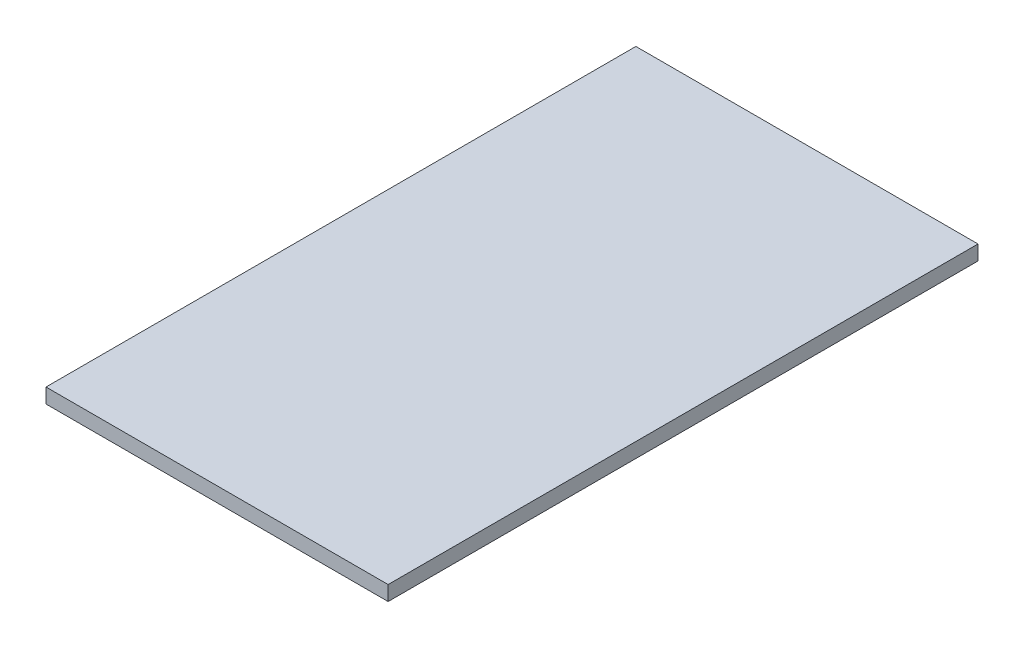
from build123d import *

# Parameters (mm, degrees)
SKETCH4_W           = 116
SKETCH4_H           = 200
BOSS_EXTRUDE1_DEPTH = 5


with BuildPart() as part:
    # Sketch4 → Boss-Extrude1 (new body)
    with BuildSketch(Plane(origin=(0, 0, 0), x_dir=(1, 0, 0), z_dir=(0, 1, 0))):
        Rectangle(SKETCH4_W, SKETCH4_H)
    extrude(amount=BOSS_EXTRUDE1_DEPTH)


solid = part.part
